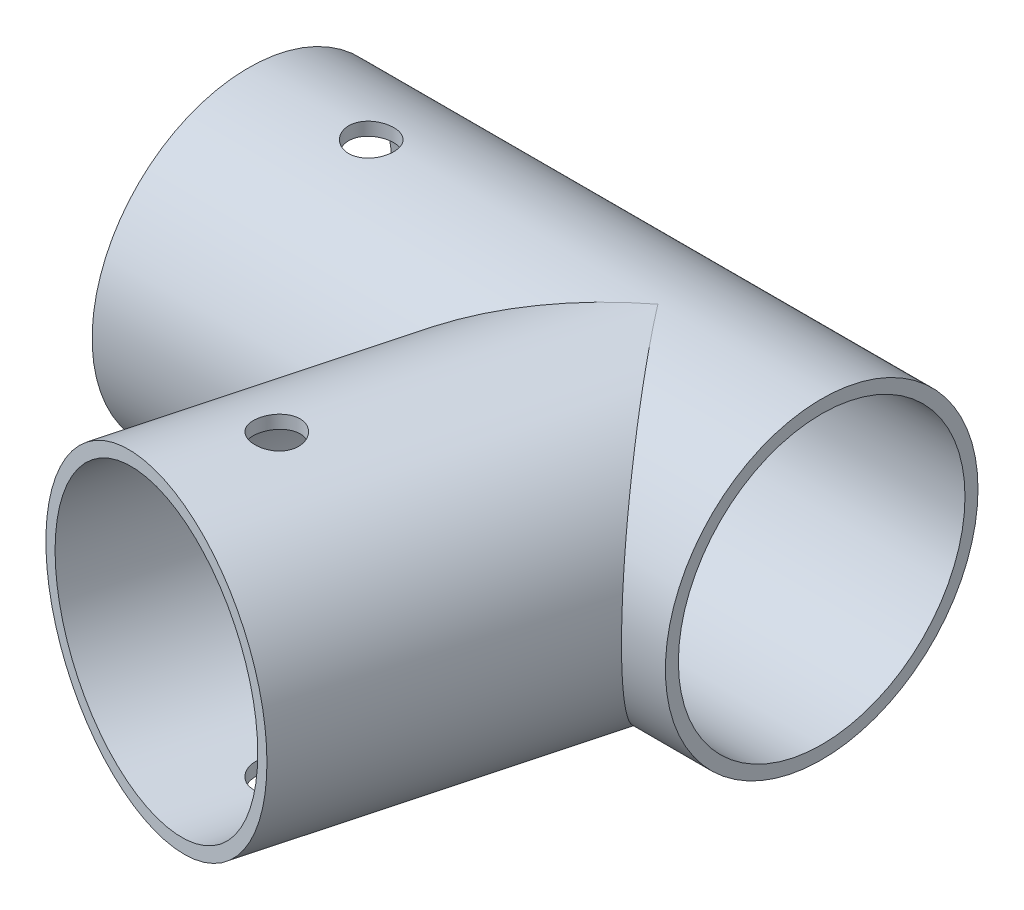
from build123d import *

# Parameters (mm, degrees)
SKETCH2_R                     = 19.0875
BOSS_EXTRUDE1_DEPTH           = 100
BOSS_EXTRUDE2_REACH           = 96.162
BOSS_EXTRUDE2_END_RADIUS      = 19.0875
SKETCH3_R                     = 19.0875
SHELL1_OUTLINE_R              = 17.5
SHELL1_DEPTH                  = 100
SHELL1_START                  = -37.059047745
SHELL1_2_OUTLINE_R            = 17.5
SHELL1_2_DEPTH                = 50.0000001
SKETCH6_W                     = 2.75
SKETCH6_H                     = 19.0875
M5_CLEARANCE_HOLE1_AT_2_COUNT = 2
M5_CLEARANCE_HOLE1_AT_2_PITCH = 44.503273363
MIRROR1_COPY_1_SKETCH_W       = 2.75
MIRROR1_COPY_1_SKETCH_H       = 19.0875
CUT_EXTRUDE1_START            = -30
SKETCH7_R                     = 19.0875
SKETCH7_R_2                   = 17.5
CUT_EXTRUDE1_DEPTH            = 30


with BuildPart() as part:
    # Sketch2 → Boss-Extrude1 (new body)
    with BuildSketch(Plane(origin=(0, 0, 0), x_dir=(0, 0, -1), z_dir=(1, 0, 0))):
        Circle(SKETCH2_R)
    extrude(amount=BOSS_EXTRUDE1_DEPTH)

    # Boss-Extrude2: up to this cylinder (the profile starts outside it)
    boss_extrude2_end = Plane(origin=(37.059048, 0, 0), z_dir=(-1, 0, 0)) * Cylinder(BOSS_EXTRUDE2_END_RADIUS, 231.499, mode=Mode.PRIVATE)
    # Sketch3 → Boss-Extrude2 (add, up to the surface)
    with BuildSketch(Plane(origin=(37.059047745, 0, 48.296291314), x_dir=(0.9659258262890673, 0, 0.2588190451025246), z_dir=(-0.2588190451025246, 0, 0.9659258262890673)), mode=Mode.PRIVATE) as boss_extrude2_sk1:
        Circle(SKETCH3_R)
    boss_extrude2_tool1 = extrude(boss_extrude2_sk1.sketch, amount=-BOSS_EXTRUDE2_REACH, mode=Mode.PRIVATE) - boss_extrude2_end
    add(boss_extrude2_tool1.solids().sort_by_distance((37.059048, 0, 48.296291))[0])

    # Shell1: read off the stored shape, not the designer's step
    # Shell1 outline → Shell1 (cut)
    with BuildSketch(Plane.YZ):
        Circle(SHELL1_OUTLINE_R)
    extrude(amount=SHELL1_DEPTH, mode=Mode.SUBTRACT)

    # Shell1 2 outline → Shell1 2 (cut)
    with BuildSketch(Plane(origin=(0, 0, 0), x_dir=(0.9659258262890672, 0, 0.2588190451025251), z_dir=(0.25881904510252507, 0, -0.9659258262890672)).offset(SHELL1_START)):
        with Locations((48.296291314, 0)):
            Circle(SHELL1_2_OUTLINE_R)
    extrude(amount=SHELL1_2_DEPTH, mode=Mode.SUBTRACT)

    # Sketch6 → M5 Clearance Hole1 (revolve, cut)
    with BuildSketch(Plane(origin=(15, 0, 0), x_dir=(0, 0, -1), z_dir=(1, 0, 0))):
        with Locations((1.375, 9.54375)):
            Rectangle(SKETCH6_W, SKETCH6_H)
    m5_clearance_hole1 = revolve(axis=Axis((15, -6.35, 0), (0, 1, 0)), mode=Mode.SUBTRACT)

    # M5 Clearance Hole1 at 2: M5 Clearance Hole1 ×2
    with Locations(*[Vector(0.5654612432844534, 0, 0.8247748676719001) * (i * M5_CLEARANCE_HOLE1_AT_2_PITCH) for i in range(1, M5_CLEARANCE_HOLE1_AT_2_COUNT)]):
        add(m5_clearance_hole1, mode=Mode.SUBTRACT)

    # Mirror1: M5 Clearance Hole1 across plane
    add(m5_clearance_hole1.mirror(Plane.ZX), mode=Mode.SUBTRACT)

    # Mirror1 copy 1 sketch → Mirror1 copy 1 (revolve, cut)
    with BuildSketch(Plane(origin=(40.164876286, 0, 36.705181399), x_dir=(0, 0, -1), z_dir=(1, 0, 0))):
        with Locations((1.375, -9.54375)):
            Rectangle(MIRROR1_COPY_1_SKETCH_W, MIRROR1_COPY_1_SKETCH_H)
    revolve(axis=Axis((40.164876286, 6.35, 36.705181399), (0, 1, 0)), mode=Mode.SUBTRACT)

    # Sketch7 → Cut-Extrude1 (cut)
    with BuildSketch(Plane(origin=(100, 0, 0), x_dir=(0, 0, -1), z_dir=(1, 0, 0)).offset(CUT_EXTRUDE1_START)):
        Circle(SKETCH7_R)
        Circle(SKETCH7_R_2, mode=Mode.SUBTRACT)
    extrude(amount=CUT_EXTRUDE1_DEPTH, mode=Mode.SUBTRACT)


solid = part.part
